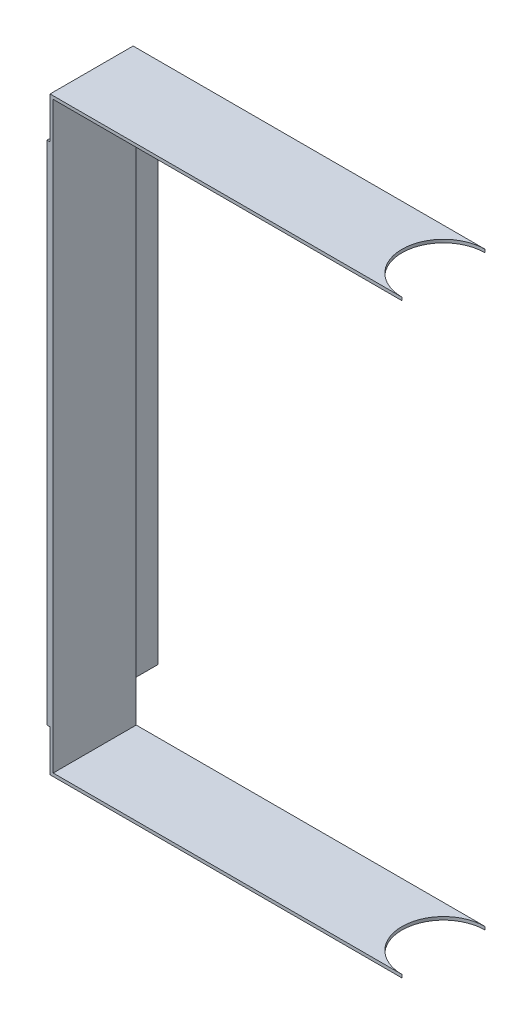
from build123d import *

# Parameters (mm, degrees)
EXTRUDE_1_DEPTH     = 40
SKETCH_2_R          = 20
CUT_EXTRUDE_1_DEPTH = 336
SKETCH_3_W          = 52
SKETCH_3_H          = 244
EXTRUDE_2_DEPTH     = 1.5


with BuildPart() as part:
    # 草图1 → 凸台-拉伸1 (new body)
    with BuildSketch(Plane.XY):
        Polygon((0, 15.741255831), (-169.5, 15.741255831), (-169.5, -268.258744169), (0, -268.258744169), (0, -266.758744169), (-168, -266.758744169), (-168, 14.241255831), (0, 14.241255831), align=None)
    extrude(amount=EXTRUDE_1_DEPTH)

    # 草图2 → 切除-拉伸1 (cut)
    with BuildSketch(Plane(origin=(0, -268.258744169, 0), x_dir=(-1, 0, 0), z_dir=(0, -1, 0))):
        with Locations((0, -20)):
            Circle(SKETCH_2_R)
    extrude(amount=-CUT_EXTRUDE_1_DEPTH, mode=Mode.SUBTRACT)

    # 草图3 → 凸台-拉伸2 (add)
    with BuildSketch(Plane.ZY.offset(169.5)):
        with Locations((14, -126.258744169)):
            Rectangle(SKETCH_3_W, SKETCH_3_H)
    extrude(amount=EXTRUDE_2_DEPTH)


solid = part.part
